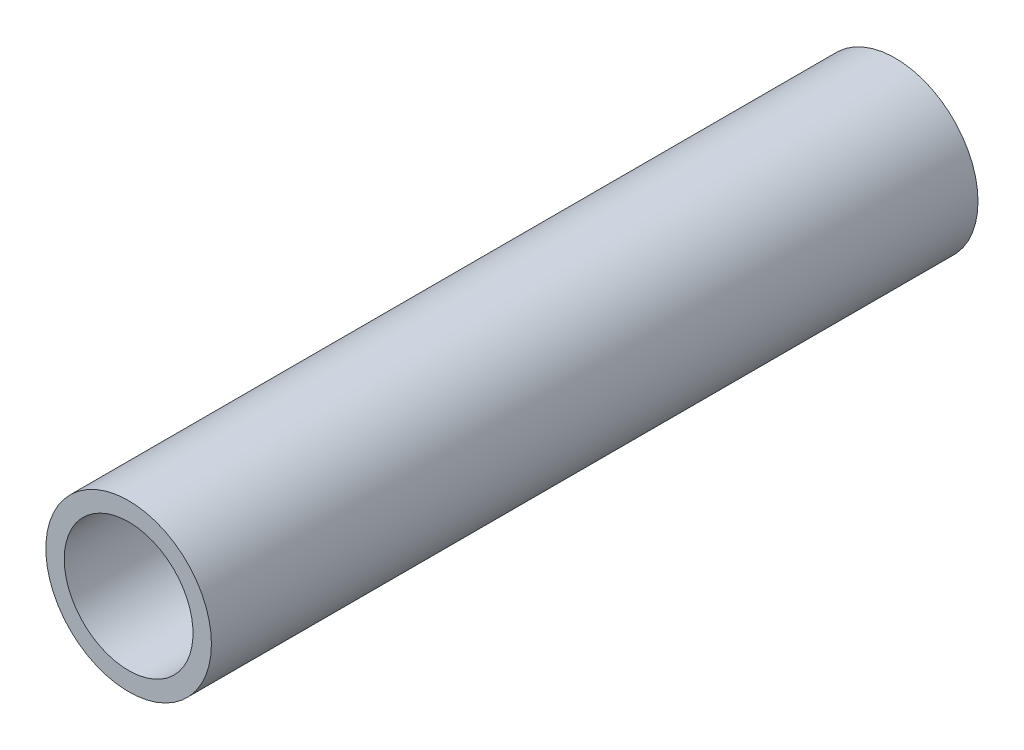
from build123d import *

# Parameters (mm, degrees)
SKETCH1_R           = 13.716
BOSS_EXTRUDE1_DEPTH = 127
SKETCH2_R           = 10.668
CUT_EXTRUDE1_DEPTH  = 127


with BuildPart() as part:
    # Sketch1 → Boss-Extrude1 (new body)
    with BuildSketch(Plane.XY):
        with Locations((-7.319167791, 4.997022186)):
            Circle(SKETCH1_R)
    extrude(amount=BOSS_EXTRUDE1_DEPTH)

    # Sketch2 → Cut-Extrude1 (cut)
    with BuildSketch(Plane(origin=(0, 0, 0), x_dir=(-1, 0, 0), z_dir=(0, 0, -1))):
        with Locations((7.319167791, 4.997022186)):
            Circle(SKETCH2_R)
    extrude(amount=-CUT_EXTRUDE1_DEPTH, mode=Mode.SUBTRACT)


solid = part.part
